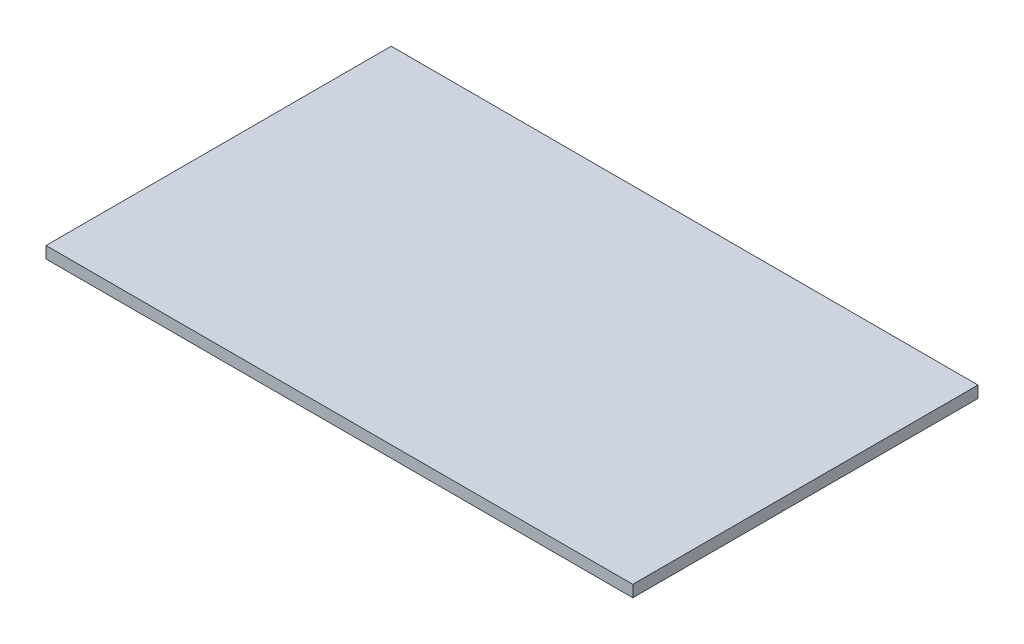
from build123d import *

# Parameters (mm, degrees)
SKETCH1_W           = 510
SKETCH1_H           = 300
BOSS_EXTRUDE1_DEPTH = 10.16


with BuildPart() as part:
    # Sketch1 → Boss-Extrude1 (new body)
    with BuildSketch(Plane(origin=(0, 0, 0), x_dir=(1, 0, 0), z_dir=(0, 1, 0))):
        with Locations((255, 150)):
            Rectangle(SKETCH1_W, SKETCH1_H)
    extrude(amount=BOSS_EXTRUDE1_DEPTH)


solid = part.part
